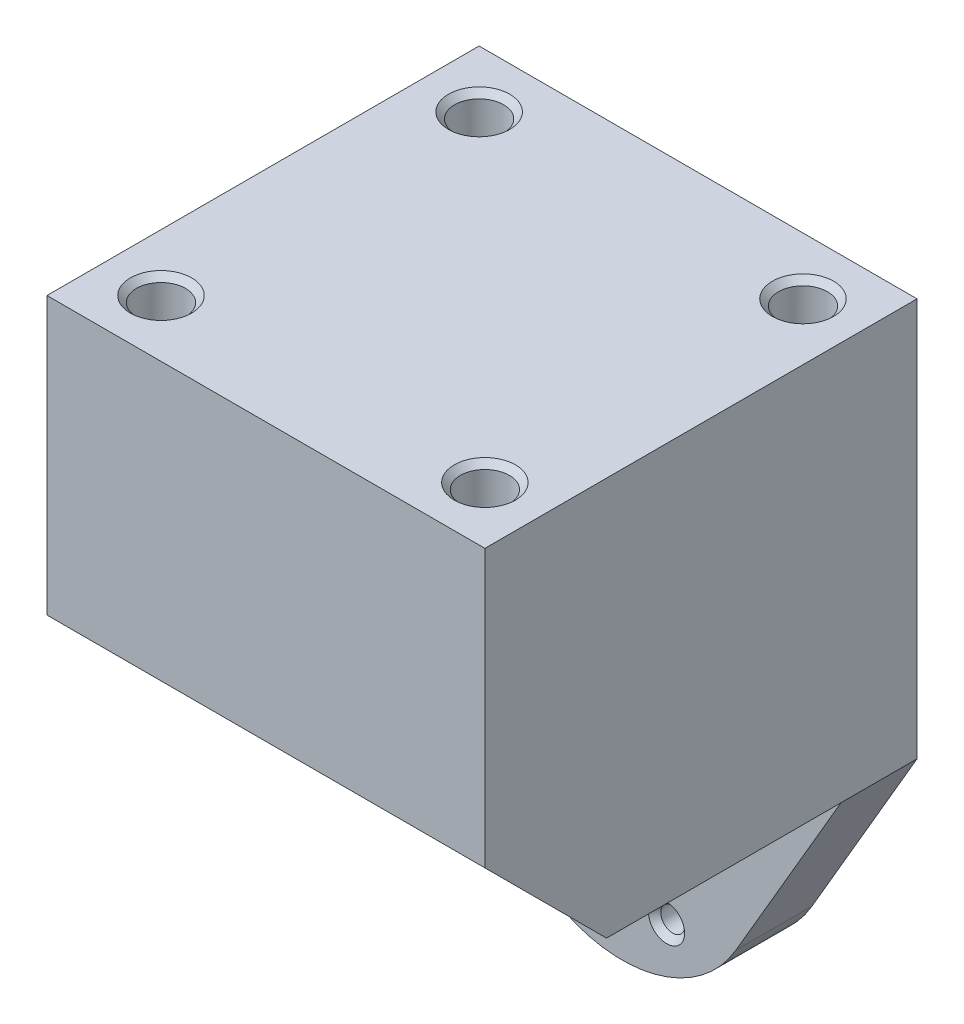
from build123d import *

# Parameters (mm, degrees)
BEARING_MOUNT_BLOCK_DEPTH                      = 10.16
BEARING_MOUNT_BLOCK_DEPTH_BACK                 = 5.08
SKETCH1_W                                      = 36.576
SKETCH1_H                                      = 33.274
ENCODER_EXTENSION_DEPTH                        = 14.5034
ENCODER_MOUNT_PLATE_DEPTH                      = 6.35
SHAFT_CLEARANCE_HOLE_REACH                     = 56.937
SKETCH6_R                                      = 3.81
F_3_48_TAPPED_HOLES_D                          = 1.9939
CBORE_FOR_4_SOCKET_HEAD_CAP_SCREW1_D           = 3.2639
CBORE_FOR_4_SOCKET_HEAD_CAP_SCREW1_DEPTH       = 12.7
CBORE_FOR_4_SOCKET_HEAD_CAP_SCREW1_CBORE_D     = 4.09575
CBORE_FOR_4_SOCKET_HEAD_CAP_SCREW1_CBORE_DEPTH = 4.7625
CBORE_FOR_4_SOCKET_HEAD_CAP_SCREW1_TIP         = 0.980574487
CBORE_FOR_4_SOCKET_HEAD_CAP_SCREW2_D           = 3.2639
CBORE_FOR_4_SOCKET_HEAD_CAP_SCREW2_DEPTH       = 12.7
CBORE_FOR_4_SOCKET_HEAD_CAP_SCREW2_CBORE_D     = 4.09575
CBORE_FOR_4_SOCKET_HEAD_CAP_SCREW2_CBORE_DEPTH = 4.7625
CBORE_FOR_4_SOCKET_HEAD_CAP_SCREW2_TIP         = 0.980574487
MATERIAL_REDUCTION_CHAMFER_SIZE                = 10.16
CHAMFER1_SIZE                                  = 0.508


with BuildPart() as part:
    # Sketch1 → Bearing Mount Block (new, two sides: drawn at the far end of the back side and taken through both)
    with BuildSketch(Plane.XY.offset(-BEARING_MOUNT_BLOCK_DEPTH_BACK)):
        Rectangle(SKETCH1_W, SKETCH1_H)
    extrude(amount=BEARING_MOUNT_BLOCK_DEPTH + BEARING_MOUNT_BLOCK_DEPTH_BACK)

    # Sketch3 → Encoder Extension (add)
    with BuildSketch(Plane(origin=(0, 0, -5.08), x_dir=(-1, 0, 0), z_dir=(0, 0, -1))):
        with BuildLine():
            Line((18.288, 16.637), (-18.288, 16.637))
            Line((-18.288, 16.637), (-18.288, -16.637))
            Line((-18.288, -16.637), (-8.22643419, -16.637))
            ThreePointArc((-8.22643419, -16.637), (0, -13.5763), (8.22643419, -16.637))
            Line((8.22643419, -16.637), (18.288, -16.637))
            Line((18.288, -16.637), (18.288, 16.637))
        make_face()
    extrude(amount=ENCODER_EXTENSION_DEPTH)

    # Sketch4 → Encoder Mount Plate (add)
    with BuildSketch(Plane(origin=(0, 0, -19.5834), x_dir=(-1, 0, 0), z_dir=(0, 0, -1))):
        with BuildLine():
            Line((18.288, 16.637), (-18.288, 16.637))
            Line((-18.288, 16.637), (-18.288, -16.637))
            Line((-18.288, -16.637), (-9.500261866, -31.703247849))
            ThreePointArc((-9.500261866, -31.703247849), (0, -37.1602), (9.500261866, -31.703247849))
            Line((9.500261866, -31.703247849), (18.288, -16.637))
            Line((18.288, -16.637), (18.288, 16.637))
        make_face()
    extrude(amount=ENCODER_MOUNT_PLATE_DEPTH)

    # Sketch6 → Shaft Clearance Hole (cut, up to next)
    with BuildSketch(Plane(origin=(0, 0, -25.9334), x_dir=(-1, 0, 0), z_dir=(0, 0, -1)), mode=Mode.PRIVATE) as shaft_clearance_hole_sk1:
        with Locations((0, -26.162)):
            Circle(SKETCH6_R)
    shaft_clearance_hole_tool1 = extrude(shaft_clearance_hole_sk1.sketch, amount=-SHAFT_CLEARANCE_HOLE_REACH, mode=Mode.PRIVATE) & part.part
    add(shaft_clearance_hole_tool1.solids().sort_by_distance((0, -26.162, -25.9334))[0], mode=Mode.SUBTRACT)

    # #3-48 Tapped Holes (through all)
    with Locations(Plane(origin=(-3.7211, -19.71686574, -25.9334), x_dir=(-1, 0, 0), z_dir=(0, 0, -1))):
        with Locations((0, 0), (-7.4422, -12.89026852)):
            Hole(F_3_48_TAPPED_HOLES_D / 2)

    # CBORE for #4 Socket Head Cap Screw1
    with Locations(Plane(origin=(-14.2875, -16.637, -2.54), x_dir=(0, 0, -1), z_dir=(0, -1, 0))):
        with Locations((0, 0), (0, 28.575)):
            CounterBoreHole(CBORE_FOR_4_SOCKET_HEAD_CAP_SCREW1_D / 2, CBORE_FOR_4_SOCKET_HEAD_CAP_SCREW1_CBORE_D / 2, CBORE_FOR_4_SOCKET_HEAD_CAP_SCREW1_CBORE_DEPTH, depth=CBORE_FOR_4_SOCKET_HEAD_CAP_SCREW1_DEPTH)
            with Locations((0, 0, -(CBORE_FOR_4_SOCKET_HEAD_CAP_SCREW1_DEPTH + CBORE_FOR_4_SOCKET_HEAD_CAP_SCREW1_TIP / 2))):  # 118° drill point
                Cone(0, CBORE_FOR_4_SOCKET_HEAD_CAP_SCREW1_D / 2, CBORE_FOR_4_SOCKET_HEAD_CAP_SCREW1_TIP, mode=Mode.SUBTRACT)

    # CBORE for #4 Socket Head Cap Screw2
    with Locations(Plane(origin=(0, 16.637, 0), x_dir=(1, 0, 0), z_dir=(0, 1, 0))):
        with Locations((-13.5255, 21.1709), (13.5255, 21.1709), (13.5255, -5.3975), (-13.5255, -5.3975)):
            CounterBoreHole(CBORE_FOR_4_SOCKET_HEAD_CAP_SCREW2_D / 2, CBORE_FOR_4_SOCKET_HEAD_CAP_SCREW2_CBORE_D / 2, CBORE_FOR_4_SOCKET_HEAD_CAP_SCREW2_CBORE_DEPTH, depth=CBORE_FOR_4_SOCKET_HEAD_CAP_SCREW2_DEPTH)
            with Locations((0, 0, -(CBORE_FOR_4_SOCKET_HEAD_CAP_SCREW2_DEPTH + CBORE_FOR_4_SOCKET_HEAD_CAP_SCREW2_TIP / 2))):  # 118° drill point
                Cone(0, CBORE_FOR_4_SOCKET_HEAD_CAP_SCREW2_D / 2, CBORE_FOR_4_SOCKET_HEAD_CAP_SCREW2_TIP, mode=Mode.SUBTRACT)

    # Material Reduction Chamfer
    material_reduction_chamfer_edges = [part.edges().sort_by_distance(p)[0] for p in [
        (0, -16.637, 10.16),
    ]]
    chamfer(material_reduction_chamfer_edges, length=MATERIAL_REDUCTION_CHAMFER_SIZE)

    # Chamfer1
    # the kernel refuses this chamfer: 0.508 mm, written as the material it takes off along each edge
    with BuildSketch(Plane(origin=(13.5255, 16.637, -21.1709), x_dir=(1, 0, 0), z_dir=(0, 0, 1))) as chamfer1_piece_1:
        Polygon((2.047875 + CHAMFER1_SIZE, 0), (2.047875, -CHAMFER1_SIZE), (2.047875, 0), align=None)
    revolve(axis=Axis((13.5255, 16.637, -21.1709), (0, 1, 0)), mode=Mode.SUBTRACT)
    with BuildSketch(Plane(origin=(-13.5255, 16.637, -21.1709), x_dir=(1, 0, 0), z_dir=(0, 0, 1))) as chamfer1_piece_2:
        Polygon((2.047875 + CHAMFER1_SIZE, 0), (2.047875, -CHAMFER1_SIZE), (2.047875, 0), align=None)
    revolve(axis=Axis((-13.5255, 16.637, -21.1709), (0, 1, 0)), mode=Mode.SUBTRACT)
    with BuildSketch(Plane(origin=(3.7211, -32.60713426, -19.5834), x_dir=(1, 0, 0), z_dir=(0, -1, 0))) as chamfer1_piece_3:
        Polygon((0.99695 + CHAMFER1_SIZE, 0), (0.99695, -CHAMFER1_SIZE), (0.99695, 0), align=None)
    revolve(axis=Axis((3.7211, -32.60713426, -19.5834), (0, 0, 1)), mode=Mode.SUBTRACT)
    with BuildSketch(Plane(origin=(-3.7211, -19.71686574, -19.5834), x_dir=(1, 0, 0), z_dir=(0, -1, 0))) as chamfer1_piece_4:
        Polygon((0.99695 + CHAMFER1_SIZE, 0), (0.99695, -CHAMFER1_SIZE), (0.99695, 0), align=None)
    revolve(axis=Axis((-3.7211, -19.71686574, -19.5834), (0, 0, 1)), mode=Mode.SUBTRACT)
    with BuildSketch(Plane(origin=(14.2875, -16.637, -2.54), x_dir=(0, 0, -1), z_dir=(-1, 0, 0))) as chamfer1_piece_5:
        Polygon((2.047875 + CHAMFER1_SIZE, 0), (2.047875, -CHAMFER1_SIZE), (2.047875, 0), align=None)
    revolve(axis=Axis((14.2875, -16.637, -2.54), (0, -1, 0)), mode=Mode.SUBTRACT)
    with BuildSketch(Plane(origin=(-14.2875, -16.637, -2.54), x_dir=(0, 0, -1), z_dir=(-1, 0, 0))) as chamfer1_piece_6:
        Polygon((2.047875 + CHAMFER1_SIZE, 0), (2.047875, -CHAMFER1_SIZE), (2.047875, 0), align=None)
    revolve(axis=Axis((-14.2875, -16.637, -2.54), (0, -1, 0)), mode=Mode.SUBTRACT)
    with BuildSketch(Plane(origin=(-13.5255, 16.637, 5.3975), x_dir=(1, 0, 0), z_dir=(0, 0, 1))) as chamfer1_piece_7:
        Polygon((2.047875 + CHAMFER1_SIZE, 0), (2.047875, -CHAMFER1_SIZE), (2.047875, 0), align=None)
    revolve(axis=Axis((-13.5255, 16.637, 5.3975), (0, 1, 0)), mode=Mode.SUBTRACT)
    with BuildSketch(Plane(origin=(13.5255, 16.637, 5.3975), x_dir=(1, 0, 0), z_dir=(0, 0, 1))) as chamfer1_piece_8:
        Polygon((2.047875 + CHAMFER1_SIZE, 0), (2.047875, -CHAMFER1_SIZE), (2.047875, 0), align=None)
    revolve(axis=Axis((13.5255, 16.637, 5.3975), (0, 1, 0)), mode=Mode.SUBTRACT)


solid = part.part
